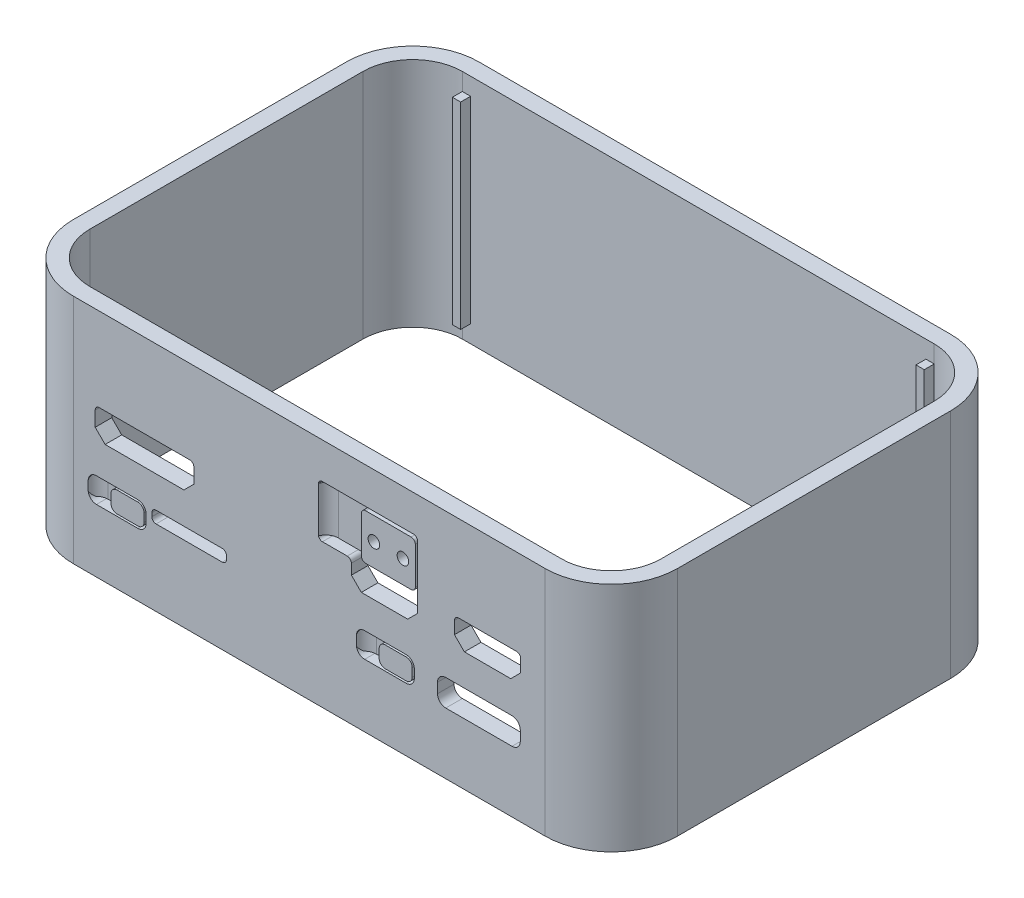
from build123d import *

# Parameters (mm, degrees)
SKETCH_1_W          = 73
SKETCH_1_H          = 49
SKETCH_1_W_2        = 69
SKETCH_1_H_2        = 45
EXTRUDE_1_DEPTH     = 28
FILLET_1_R          = 6
FILLET_2_R          = 8
CUT_EXTRUDE_1_REACH = 69.849
SKETCH_2_W          = 11.917601031
SKETCH_2_H          = 3.5
SKETCH_2_W_2        = 8
SKETCH_2_H_2        = 3.2
SKETCH_2_W_3        = 7
SKETCH_2_H_3        = 3
SKETCH_2_W_4        = 9
SKETCH_2_H_4        = 1.436215651
SKETCH_2_W_5        = 10
CHAMFER_1_SIZE      = 1.2
FILLET_3_R          = 0.5
FILLET_4_R          = 1
EXTRUDE_2_DEPTH     = 1
EXTRUDE_3_DEPTH     = 1
CUT_EXTRUDE_2_REACH = 69.849
SKETCH_5_R          = 0.7
FILLET_START        = 17.7
FILLET_5_DEPTH      = 5.5
FILLET_START_2      = 7.85
FILLET_5_2_DEPTH    = 2.5
EXTRUDE_START       = 0.9
EXTRUDE_4_DEPTH     = 0.9
SKETCH_7_W          = 1
SKETCH_7_H          = 23.8
EXTRUDE_5_DEPTH     = 1.2
SKETCH_8_W          = 1
SKETCH_8_H          = 23.8
EXTRUDE_6_DEPTH     = 1.2


with BuildPart() as part:
    # 草图1 → 凸台-拉伸1 (new body)
    with BuildSketch(Plane(origin=(0, 0, 0), x_dir=(1, 0, 0), z_dir=(0, 1, 0))):
        with Locations((1.162504827, 5.939107883)):
            Rectangle(SKETCH_1_W, SKETCH_1_H)
        with Locations((1.162504827, 5.939107883)):
            Rectangle(SKETCH_1_W_2, SKETCH_1_H_2, mode=Mode.SUBTRACT)
    extrude(amount=EXTRUDE_1_DEPTH)

    # 圆角1
    fillet_1_edges = [part.edges().sort_by_distance(p)[0] for p in [
        (-33.337495173, 14, -28.439107883),
        (-33.337495173, 14, 16.560892117),
        (35.662504827, 14, 16.560892117),
        (35.662504827, 14, -28.439107883),
    ]]
    fillet(fillet_1_edges, radius=FILLET_1_R)

    # 圆角2
    fillet_2_edges = [part.edges().sort_by_distance(p)[0] for p in [
        (-35.337495173, 14, -30.439107883),
        (37.662504827, 14, -30.439107883),
        (37.662504827, 14, 18.560892117),
        (-35.337495173, 14, 18.560892117),
    ]]
    fillet(fillet_2_edges, radius=FILLET_2_R)

    # 草图2 → 切除-拉伸1 (cut, up to next)
    with BuildSketch(Plane.XY.offset(18.560892117), mode=Mode.PRIVATE) as cut_extrude_1_sk1:
        Polygon((6.262504827, 17.35), (2.262504827, 17.35), (2.262504827, 23.65), (14.262504827, 23.65), (14.262504827, 14.4), (6.262504827, 14.4), align=None)
    cut_extrude_1_tool1 = extrude(cut_extrude_1_sk1.sketch, amount=-CUT_EXTRUDE_1_REACH, mode=Mode.PRIVATE) & part.part
    # 草图2 → 切除-拉伸1 (cut, up to next)
    with BuildSketch(Plane.XY.offset(18.560892117), mode=Mode.PRIVATE) as cut_extrude_1_sk2:
        with Locations((-18.728694658, 16.15)):
            Rectangle(SKETCH_2_W, SKETCH_2_H)
    cut_extrude_1_tool2 = extrude(cut_extrude_1_sk2.sketch, amount=-CUT_EXTRUDE_1_REACH, mode=Mode.PRIVATE) & part.part
    # 草图2 → 切除-拉伸1 (cut, up to next)
    with BuildSketch(Plane.XY.offset(18.560892117), mode=Mode.PRIVATE) as cut_extrude_1_sk3:
        with Locations((22.712504827, 16)):
            Rectangle(SKETCH_2_W_2, SKETCH_2_H_2)
    cut_extrude_1_tool3 = extrude(cut_extrude_1_sk3.sketch, amount=-CUT_EXTRUDE_1_REACH, mode=Mode.PRIVATE) & part.part
    # 草图2 → 切除-拉伸1 (cut, up to next)
    with BuildSketch(Plane.XY.offset(18.560892117), mode=Mode.PRIVATE) as cut_extrude_1_sk4:
        with Locations((-22.037495173, 9.1)):
            Rectangle(SKETCH_2_W_3, SKETCH_2_H_3)
    cut_extrude_1_tool4 = extrude(cut_extrude_1_sk4.sketch, amount=-CUT_EXTRUDE_1_REACH, mode=Mode.PRIVATE) & part.part
    # 草图2 → 切除-拉伸1 (cut, up to next)
    with BuildSketch(Plane.XY.offset(18.560892117), mode=Mode.PRIVATE) as cut_extrude_1_sk5:
        with Locations((-13.337495173, 9.881892175)):
            Rectangle(SKETCH_2_W_4, SKETCH_2_H_4)
    cut_extrude_1_tool5 = extrude(cut_extrude_1_sk5.sketch, amount=-CUT_EXTRUDE_1_REACH, mode=Mode.PRIVATE) & part.part
    # 草图2 → 切除-拉伸1 (cut, up to next)
    with BuildSketch(Plane.XY.offset(18.560892117), mode=Mode.PRIVATE) as cut_extrude_1_sk6:
        with Locations((10.362504827, 9.1)):
            Rectangle(SKETCH_2_W_3, SKETCH_2_H_3)
    cut_extrude_1_tool6 = extrude(cut_extrude_1_sk6.sketch, amount=-CUT_EXTRUDE_1_REACH, mode=Mode.PRIVATE) & part.part
    # 草图2 → 切除-拉伸1 (cut, up to next)
    with BuildSketch(Plane.XY.offset(18.560892117), mode=Mode.PRIVATE) as cut_extrude_1_sk7:
        with Locations((21.662504827, 9)):
            Rectangle(SKETCH_2_W_5, SKETCH_2_H_2)
    cut_extrude_1_tool7 = extrude(cut_extrude_1_sk7.sketch, amount=-CUT_EXTRUDE_1_REACH, mode=Mode.PRIVATE) & part.part
    add(cut_extrude_1_tool1.solids().sort_by_distance((8.738311, 19.399698, 18.560892))[0], mode=Mode.SUBTRACT)
    add(cut_extrude_1_tool2.solids().sort_by_distance((-18.728695, 16.15, 18.560892))[0], mode=Mode.SUBTRACT)
    add(cut_extrude_1_tool3.solids().sort_by_distance((22.712505, 16, 18.560892))[0], mode=Mode.SUBTRACT)
    add(cut_extrude_1_tool4.solids().sort_by_distance((-22.037495, 9.1, 18.560892))[0], mode=Mode.SUBTRACT)
    add(cut_extrude_1_tool5.solids().sort_by_distance((-13.337495, 9.881892, 18.560892))[0], mode=Mode.SUBTRACT)
    add(cut_extrude_1_tool6.solids().sort_by_distance((10.362505, 9.1, 18.560892))[0], mode=Mode.SUBTRACT)
    add(cut_extrude_1_tool7.solids().sort_by_distance((21.662505, 9, 18.560892))[0], mode=Mode.SUBTRACT)

    # 倒角1
    chamfer_1_edges = [part.edges().sort_by_distance(p)[0] for p in [
        (6.262504827, 14.4, 17.560892117),
        (14.262504827, 14.4, 17.560892117),
        (18.712504827, 14.4, 17.560892117),
        (26.712504827, 14.4, 17.560892117),
        (-24.687495173, 14.4, 17.560892117),
        (-12.769894142, 14.4, 17.560892117),
    ]]
    chamfer(chamfer_1_edges, length=CHAMFER_1_SIZE)

    # 圆角3
    fillet_3_edges = [part.edges().sort_by_distance(p)[0] for p in [
        (6.262504827, 17.35, 17.560892117),
        (2.262504827, 17.35, 17.560892117),
        (2.262504827, 23.65, 17.560892117),
        (14.262504827, 23.65, 17.560892117),
        (18.712504827, 17.6, 17.560892117),
        (26.712504827, 17.6, 17.560892117),
        (-17.837495173, 9.163784349, 17.560892117),
        (-17.837495173, 10.6, 17.560892117),
        (-8.837495173, 10.6, 17.560892117),
        (-8.837495173, 9.163784349, 17.560892117),
        (-24.687495173, 17.9, 17.560892117),
        (-12.769894142, 17.9, 17.560892117),
    ]]
    fillet(fillet_3_edges, radius=FILLET_3_R)

    # 圆角4
    fillet_4_edges = [part.edges().sort_by_distance(p)[0] for p in [
        (-25.537495173, 7.6, 17.560892117),
        (-25.537495173, 10.6, 17.560892117),
        (-18.537495173, 10.6, 17.560892117),
        (-18.537495173, 7.6, 17.560892117),
        (6.862504827, 7.6, 17.560892117),
        (6.862504827, 10.6, 17.560892117),
        (13.862504827, 10.6, 17.560892117),
        (13.862504827, 7.6, 17.560892117),
        (16.662504827, 7.4, 17.560892117),
        (16.662504827, 10.6, 17.560892117),
        (26.662504827, 10.6, 17.560892117),
        (26.662504827, 7.4, 17.560892117),
    ]]
    fillet(fillet_4_edges, radius=FILLET_4_R)

    # 草图3 → 凸台-拉伸2 (add)
    with BuildSketch(Plane(origin=(0, 0, 16.560892117), x_dir=(-1, 0, 0), z_dir=(0, 0, -1))):
        with BuildLine():
            Line((-13.482569499, 23.2), (-1.742096289, 23.2))
            Line((-1.742096289, 23.2), (-1.742096289, 17.7))
            Line((-1.742096289, 17.7), (-13.482569499, 17.7))
            ThreePointArc((-13.482569499, 17.7), (-13.83612289, 17.846446609), (-13.982569499, 18.2))
            Line((-13.982569499, 18.2), (-13.982569499, 22.7))
            ThreePointArc((-13.982569499, 22.7), (-13.83612289, 23.053553391), (-13.482569499, 23.2))
        make_face()
        with BuildLine():
            Line((-5.804591669, 10.35), (-12.861926135, 10.35))
            ThreePointArc((-12.861926135, 10.35), (-13.392256221, 10.130330086), (-13.611926135, 9.6))
            Line((-13.611926135, 9.6), (-13.611926135, 8.6))
            ThreePointArc((-13.611926135, 8.6), (-13.392256221, 8.069669914), (-12.861926135, 7.85))
            Line((-12.861926135, 7.85), (-5.804591669, 7.85))
            Line((-5.804591669, 7.85), (-5.804591669, 10.35))
        make_face()
        with BuildLine():
            Line((26.313380394, 10.35), (19.537495173, 10.35))
            ThreePointArc((19.537495173, 10.35), (19.007165088, 10.130330086), (18.787495173, 9.6))
            Line((18.787495173, 9.6), (18.787495173, 8.6))
            ThreePointArc((18.787495173, 8.6), (19.007165088, 8.069669914), (19.537495173, 7.85))
            Line((19.537495173, 7.85), (26.313380394, 7.85))
            Line((26.313380394, 7.85), (26.313380394, 10.35))
        make_face()
    extrude(amount=-EXTRUDE_2_DEPTH)

    # 草图4 → 凸台-拉伸3 (add)
    with BuildSketch(Plane.XY.offset(17.560892117)):
        with BuildLine():
            Line((13.482569499, 23.2), (7.982569499, 23.2))
            ThreePointArc((7.982569499, 23.2), (7.629016109, 23.053553391), (7.482569499, 22.7))
            Line((7.482569499, 22.7), (7.482569499, 18.2))
            ThreePointArc((7.482569499, 18.2), (7.629016109, 17.846446609), (7.982569499, 17.7))
            Line((7.982569499, 17.7), (13.482569499, 17.7))
            ThreePointArc((13.482569499, 17.7), (13.83612289, 17.846446609), (13.982569499, 18.2))
            Line((13.982569499, 18.2), (13.982569499, 22.7))
            ThreePointArc((13.982569499, 22.7), (13.83612289, 23.053553391), (13.482569499, 23.2))
        make_face()
        with BuildLine():
            Line((-22.037495173, 7.85), (-19.537495173, 7.85))
            ThreePointArc((-19.537495173, 7.85), (-19.007165088, 8.069669914), (-18.787495173, 8.6))
            Line((-18.787495173, 8.6), (-18.787495173, 9.6))
            ThreePointArc((-18.787495173, 9.6), (-19.007165088, 10.130330086), (-19.537495173, 10.35))
            Line((-19.537495173, 10.35), (-22.037495173, 10.35))
            ThreePointArc((-22.037495173, 10.35), (-22.567825259, 10.130330086), (-22.787495173, 9.6))
            Line((-22.787495173, 9.6), (-22.787495173, 8.6))
            ThreePointArc((-22.787495173, 8.6), (-22.567825259, 8.069669914), (-22.037495173, 7.85))
        make_face()
        with BuildLine():
            Line((10.361926135, 7.85), (12.861926135, 7.85))
            ThreePointArc((12.861926135, 7.85), (13.392256221, 8.069669914), (13.611926135, 8.6))
            Line((13.611926135, 8.6), (13.611926135, 9.6))
            ThreePointArc((13.611926135, 9.6), (13.392256221, 10.130330086), (12.861926135, 10.35))
            Line((12.861926135, 10.35), (10.361926135, 10.35))
            ThreePointArc((10.361926135, 10.35), (9.831596049, 10.130330086), (9.611926135, 9.6))
            Line((9.611926135, 9.6), (9.611926135, 8.6))
            ThreePointArc((9.611926135, 8.6), (9.831596049, 8.069669914), (10.361926135, 7.85))
        make_face()
    extrude(amount=EXTRUDE_3_DEPTH)

    # 草图5 → 切除-拉伸2 (cut, up to next)
    with BuildSketch(Plane.XY.offset(18.560892117), mode=Mode.PRIVATE) as cut_extrude_2_sk1:
        with Locations((8.982569499, 20.45)):
            Circle(SKETCH_5_R)
    cut_extrude_2_tool1 = extrude(cut_extrude_2_sk1.sketch, amount=-CUT_EXTRUDE_2_REACH, mode=Mode.PRIVATE) & part.part
    # 草图5 → 切除-拉伸2 (cut, up to next)
    with BuildSketch(Plane.XY.offset(18.560892117), mode=Mode.PRIVATE) as cut_extrude_2_sk2:
        with Locations((12.482569499, 20.45)):
            Circle(SKETCH_5_R)
    cut_extrude_2_tool2 = extrude(cut_extrude_2_sk2.sketch, amount=-CUT_EXTRUDE_2_REACH, mode=Mode.PRIVATE) & part.part
    add(cut_extrude_2_tool1.solids().sort_by_distance((8.982569, 20.45, 18.560892))[0], mode=Mode.SUBTRACT)
    add(cut_extrude_2_tool2.solids().sort_by_distance((12.482569, 20.45, 18.560892))[0], mode=Mode.SUBTRACT)

    # 圆角5: read off the stored shape, not the designer's step
    # 圆角5 outline → 圆角5 (add)
    with BuildSketch(Plane(origin=(0, 0, 0), x_dir=(1, 0, 0), z_dir=(0, 1, 0)).offset(FILLET_START)):
        with BuildLine():
            ThreePointArc((2.262503032, -18.560897193), (2.810690787, -17.8361488), (3.676718389, -17.560892117))
            Line((3.676718389, -17.560892117), (2.262504827, -17.560892117))
            Line((2.262504827, -17.560892117), (2.262503032, -18.560897193))
        make_face()
    extrude(amount=FILLET_5_DEPTH)

    # Fillet 5 2 outline → Fillet 5 2 (add)
    with BuildSketch(Plane(origin=(0, 0, 0), x_dir=(1, 0, 0), z_dir=(0, 1, 0)).offset(FILLET_START_2)):
        with BuildLine():
            Line((6.862504827, -17.560892117), (6.862492124, -18.560928045))
            ThreePointArc((6.862492124, -18.560928045), (7.410677428, -17.836158246), (8.276718389, -17.560892117))
            Line((8.276718389, -17.560892117), (6.862504827, -17.560892117))
        make_face()
        with BuildLine():
            Line((-25.537495173, -17.560892117), (-25.537507876, -18.560928045))
            ThreePointArc((-25.537507876, -18.560928045), (-24.989322572, -17.836158246), (-24.123281611, -17.560892117))
            Line((-24.123281611, -17.560892117), (-25.537495173, -17.560892117))
        make_face()
    extrude(amount=FILLET_5_2_DEPTH)

    # 草图6 → 凸台-拉伸4 (add)
    with BuildSketch(Plane(origin=(0, 0, 16.560892117), x_dir=(-1, 0, 0), z_dir=(0, 0, -1)).offset(EXTRUDE_START)):
        with BuildLine():
            Line((-13.611926135, 8.6), (-13.611926135, 9.6))
            ThreePointArc((-13.611926135, 9.6), (-13.392256221, 10.130330086), (-12.861926135, 10.35))
            Line((-12.861926135, 10.35), (-10.361926135, 10.35))
            ThreePointArc((-10.361926135, 10.35), (-9.831596049, 10.130330086), (-9.611926135, 9.6))
            Line((-9.611926135, 9.6), (-9.611926135, 8.6))
            ThreePointArc((-9.611926135, 8.6), (-9.831596049, 8.069669914), (-10.361926135, 7.85))
            Line((-10.361926135, 7.85), (-12.861926135, 7.85))
            ThreePointArc((-12.861926135, 7.85), (-13.392256221, 8.069669914), (-13.611926135, 8.6))
        make_face()
        with BuildLine():
            Line((18.787495173, 8.6), (18.787495173, 9.6))
            ThreePointArc((18.787495173, 9.6), (19.007165088, 10.130330086), (19.537495173, 10.35))
            Line((19.537495173, 10.35), (22.037495173, 10.35))
            ThreePointArc((22.037495173, 10.35), (22.567825259, 10.130330086), (22.787495173, 9.6))
            Line((22.787495173, 9.6), (22.787495173, 8.6))
            ThreePointArc((22.787495173, 8.6), (22.567825259, 8.069669914), (22.037495173, 7.85))
            Line((22.037495173, 7.85), (19.537495173, 7.85))
            ThreePointArc((19.537495173, 7.85), (19.007165088, 8.069669914), (18.787495173, 8.6))
        make_face()
    extrude(amount=-EXTRUDE_4_DEPTH)

    # 草图7 → 凸台-拉伸5 (add)
    with BuildSketch(Plane(origin=(0, 0, 16.560892117), x_dir=(-1, 0, 0), z_dir=(0, 0, -1))):
        with Locations((-29.162504827, 14)):
            Rectangle(SKETCH_7_W, SKETCH_7_H)
        with Locations((26.837495173, 14)):
            Rectangle(SKETCH_7_W, SKETCH_7_H)
    extrude(amount=EXTRUDE_5_DEPTH)

    # 草图8 → 凸台-拉伸6 (add)
    with BuildSketch(Plane.XY.offset(-28.439107883)):
        with Locations((-26.837495173, 14)):
            Rectangle(SKETCH_8_W, SKETCH_8_H)
        with Locations((29.162504827, 14)):
            Rectangle(SKETCH_8_W, SKETCH_8_H)
    extrude(amount=EXTRUDE_6_DEPTH)


solid = part.part
